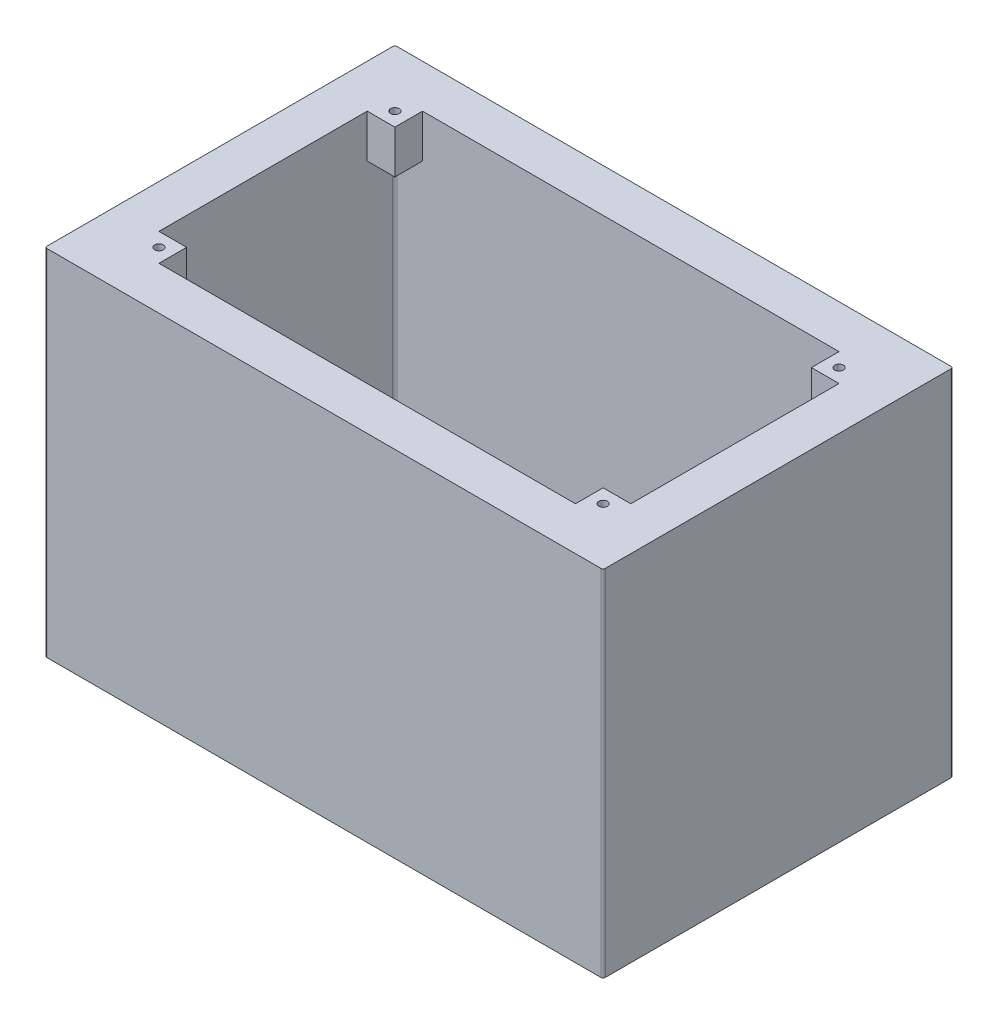
from build123d import *

# Parameters (mm, degrees)
SKETCH1_W           = 64.6
SKETCH1_H           = 40.5
BOSS_EXTRUDE1_DEPTH = 2.5
SKETCH3_W           = 64.6
SKETCH3_H           = 40.5
SKETCH3_W_2         = 54.6
SKETCH3_H_2         = 30.5
BOSS_EXTRUDE4_DEPTH = 38.5
SKETCH4_W           = 3.2
SKETCH4_H           = 3.2
SKETCH4_R           = 0.5
BOSS_EXTRUDE7_DEPTH = 5
FILLET1_R           = 0.25
FILLET2_R           = 0.25
SKETCH6_R           = 2
CUT_EXTRUDE1_DEPTH  = 5
FILLET4_R           = 0.3


with BuildPart() as part:
    # Sketch1 → Boss-Extrude1 (new body)
    with BuildSketch(Plane(origin=(0, 0, 0), x_dir=(1, 0, 0), z_dir=(0, 1, 0))):
        Rectangle(SKETCH1_W, SKETCH1_H)
    extrude(amount=BOSS_EXTRUDE1_DEPTH)

    # Sketch3 → Boss-Extrude4 (add)
    with BuildSketch(Plane(origin=(0, 2.5, 0), x_dir=(1, 0, 0), z_dir=(0, 1, 0))):
        Rectangle(SKETCH3_W, SKETCH3_H)
        Rectangle(SKETCH3_W_2, SKETCH3_H_2, mode=Mode.SUBTRACT)
    extrude(amount=BOSS_EXTRUDE4_DEPTH)

    # Sketch4 → Boss-Extrude7 (add)
    # profile 1 of 4: a face of its own
    with BuildSketch(Plane(origin=(0, 41, 0), x_dir=(1, 0, 0), z_dir=(0, 1, 0))):
        with Locations((-25.7, 13.65)):
            Rectangle(SKETCH4_W, SKETCH4_H)
        with Locations((-25.7, 13.65)):
            Circle(SKETCH4_R, mode=Mode.SUBTRACT)
    # profile 2 of 4: a face of its own
    with BuildSketch(Plane(origin=(0, 41, 0), x_dir=(1, 0, 0), z_dir=(0, 1, 0))):
        with Locations((25.7, 13.65)):
            Rectangle(SKETCH4_W, SKETCH4_H)
        with Locations((25.7, 13.65)):
            Circle(SKETCH4_R, mode=Mode.SUBTRACT)
    # profile 3 of 4: a face of its own
    with BuildSketch(Plane(origin=(0, 41, 0), x_dir=(1, 0, 0), z_dir=(0, 1, 0))):
        with Locations((25.7, -13.65)):
            Rectangle(SKETCH4_W, SKETCH4_H)
        with Locations((25.7, -13.65)):
            Circle(SKETCH4_R, mode=Mode.SUBTRACT)
    # profile 4 of 4: a face of its own
    with BuildSketch(Plane(origin=(0, 41, 0), x_dir=(1, 0, 0), z_dir=(0, 1, 0))):
        with Locations((-25.7, -13.65)):
            Rectangle(SKETCH4_W, SKETCH4_H)
        with Locations((-25.7, -13.65)):
            Circle(SKETCH4_R, mode=Mode.SUBTRACT)
    extrude(amount=-BOSS_EXTRUDE7_DEPTH)

    # Fillet1
    fillet1_edges = [part.edges().sort_by_distance(p)[0] for p in [
        (32.3, 20.5, -20.25),
        (32.3, 20.5, 20.25),
        (-32.3, 20.5, -20.25),
        (-32.3, 20.5, 20.25),
    ]]
    fillet(fillet1_edges, radius=FILLET1_R)

    # Fillet2
    fillet2_edges = [part.edges().sort_by_distance(p)[0] for p in [
        (27.3, 19.25, 15.25),
        (-27.3, 19.25, 15.25),
        (27.3, 19.25, -15.25),
        (0, 2.5, -15.25),
        (-27.3, 19.25, -15.25),
    ]]
    fillet(fillet2_edges, radius=FILLET2_R)

    # Sketch6 → Cut-Extrude1 (cut)
    with BuildSketch(Plane.ZY.offset(32.3)):
        with Locations((8, 12)):
            Circle(SKETCH6_R)
    extrude(amount=-CUT_EXTRUDE1_DEPTH, mode=Mode.SUBTRACT)

    # Fillet4
    fillet4_edges = [part.edges().sort_by_distance(p)[0] for p in [
        (-32.3, 12, 6),
    ]]
    fillet(fillet4_edges, radius=FILLET4_R)


solid = part.part
